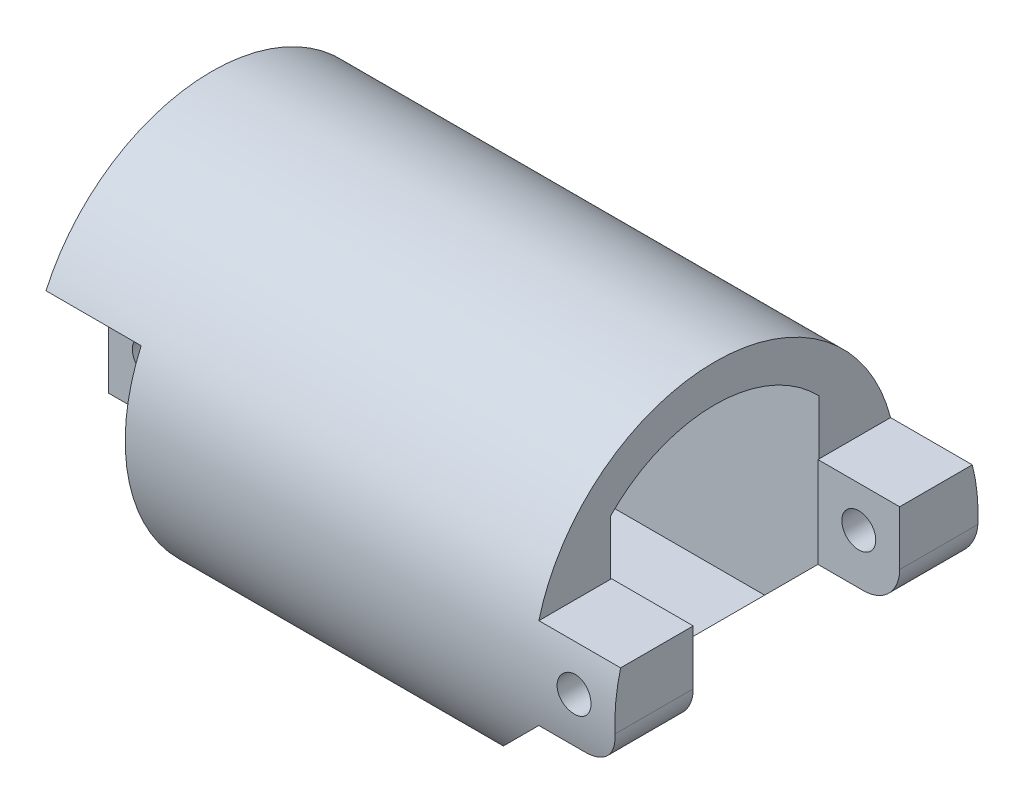
from build123d import *
from build123d.topology import SkipClean

# Parameters (mm, degrees)
SKETCH1_R           = 10
BOSS_EXTRUDE1_DEPTH = 10
SKETCH4_R           = 1.305
CUT_EXTRUDE3_DEPTH  = 25.5
BOSS_EXTRUDE2_START = 4.5
BOSS_EXTRUDE2_DEPTH = 4.5
SKETCH6_R           = 0.935
CUT_EXTRUDE4_DEPTH  = 12.25
SKETCH7_W           = 11.364916732
SKETCH7_H           = 5
BOSS_EXTRUDE3_DEPTH = 4.5
SKETCH8_R           = 0.935
CUT_EXTRUDE5_DEPTH  = 7.25
BOSS_EXTRUDE4_DEPTH = 4.5
CUT_EXTRUDE6_START  = -0.75
CUT_EXTRUDE6_DEPTH  = 0.75
SKETCH12_W          = 5.25
SKETCH12_H          = 4
CUT_EXTRUDE7_DEPTH  = 1.6
CUT_EXTRUDE8_DEPTH  = 15.8
FILLET1_R           = 2
CUT_EXTRUDE9_DEPTH  = 10.8
SKETCH15_W          = 11.364916732
SKETCH15_H          = 6.6
CUT_EXTRUDE10_DEPTH = 1.6
CUT_EXTRUDE11_DEPTH = 15
BOSS_EXTRUDE5_REACH = 35.438
SKETCH17_R          = 10
SKETCH17_R_2        = 1.305
CUT_EXTRUDE12_DEPTH = 14
SCALE1_SCALE        = 0.8


with BuildPart() as part:
    # Sketch1 → Boss-Extrude1 (new, symmetric)
    with BuildSketch(Plane(origin=(0, 0, 0), x_dir=(0, 0, -1), z_dir=(1, 0, 0))):
        Circle(SKETCH1_R)
    extrude(amount=BOSS_EXTRUDE1_DEPTH, both=True)

    # Sketch4 → Cut-Extrude3 (cut, symmetric)
    with BuildSketch(Plane(origin=(0, -0.76336978, 0), x_dir=(0, 0, -1), z_dir=(1, 0, 0))):
        with Locations((0, -6.913267104)):
            Circle(SKETCH4_R)
    extrude(amount=CUT_EXTRUDE3_DEPTH, both=True, mode=Mode.SUBTRACT)

    # Sketch5 → Boss-Extrude2 (add)
    with BuildSketch(Plane(origin=(10, 0, 0), x_dir=(0, 0, -1), z_dir=(1, 0, 0)).offset(BOSS_EXTRUDE2_START)):
        with BuildLine():
            Line((-9.682458366, -2.5), (-5.682458366, -2.5))
            Line((-5.682458366, -2.5), (-5.682458366, 2.5))
            Line((-5.682458366, 2.5), (-9.682458366, 2.5))
            ThreePointArc((-9.682458366, 2.5), (-10, 0), (-9.682458366, -2.5))
        make_face()
    boss_extrude2 = extrude(amount=-BOSS_EXTRUDE2_DEPTH)

    # Mirror1: Boss-Extrude2 across plane
    add(boss_extrude2.mirror(Plane.XY))

    # Sketch6 → Cut-Extrude4 (cut, symmetric)
    with SkipClean():  # the faces are left unmerged after this step: merging them gives an invalid solid
        with BuildSketch(Plane.XY):
            with Locations((12.25, 0.25)):
                Circle(SKETCH6_R)
        extrude(amount=CUT_EXTRUDE4_DEPTH, both=True, mode=Mode.SUBTRACT)

    # Sketch7 → Boss-Extrude3 (add)
    with SkipClean():  # the faces are left unmerged after this step: merging them gives an invalid solid
        with BuildSketch(Plane.ZY.offset(10)):
            Rectangle(SKETCH7_W, SKETCH7_H)
        extrude(amount=BOSS_EXTRUDE3_DEPTH)

    # Sketch8 → Cut-Extrude5 (cut, symmetric)
    with SkipClean():  # the faces are left unmerged after this step: merging them gives an invalid solid
        with BuildSketch(Plane.XY):
            with Locations((-12.25, 0.25)):
                Circle(SKETCH8_R)
        extrude(amount=CUT_EXTRUDE5_DEPTH, both=True, mode=Mode.SUBTRACT)

    # Sketch10 → Boss-Extrude4 (add)
    with SkipClean():  # the faces are left unmerged after this step: merging them gives an invalid solid
        with BuildSketch(Plane.ZY.offset(10)):
            with BuildLine():
                Line((9.682458366, 2.5), (-9.682458366, 2.5))
                ThreePointArc((-9.682458366, 2.5), (0, 10), (9.682458366, 2.5))
            make_face()
        extrude(amount=BOSS_EXTRUDE4_DEPTH)

    # Cut-Extrude6: read off the stored shape, not the designer's step
    # Cut-Extrude6 outline → Cut-Extrude6 (cut)
    with SkipClean():  # the faces are left unmerged after this step: merging them gives an invalid solid
        with BuildSketch(Plane.ZY.offset(10).offset(CUT_EXTRUDE6_START)):
            with BuildLine():
                ThreePointArc((-9.682458366, 2.5), (-9.369942303, -3.493448331), (-5.682458366, -8.228588392))
                Line((-5.682458366, -8.228588392), (-5.682458366, 2.5))
                Line((-5.682458366, 2.5), (-9.682458366, 2.5))
            make_face()
            with BuildLine():
                Line((5.682458366, 2.5), (5.682458366, -8.228588392))
                ThreePointArc((5.682458366, -8.228588392), (9.369942303, -3.493448331), (9.682458366, 2.5))
                Line((9.682458366, 2.5), (5.682458366, 2.5))
            make_face()
        extrude(amount=CUT_EXTRUDE6_DEPTH, mode=Mode.SUBTRACT)

    # Sketch12 → Cut-Extrude7 (cut)
    with SkipClean():  # the faces are left unmerged after this step: merging them gives an invalid solid
        with BuildSketch(Plane.XZ.offset(-2.5)):
            with Locations((-11.875, -7.682458366)):
                Rectangle(SKETCH12_W, SKETCH12_H)
            with Locations((-11.875, 7.682458366)):
                Rectangle(SKETCH12_W, SKETCH12_H)
        extrude(amount=-CUT_EXTRUDE7_DEPTH, mode=Mode.SUBTRACT)

    # Sketch13 → Cut-Extrude8 (cut, symmetric)
    with SkipClean():  # the faces are left unmerged after this step: merging them gives an invalid solid
        with BuildSketch(Plane.XY):
            Polygon((-10, -8.228588392), (-10, -2.5), (-2.5, -10), (-10, -10), align=None)
        extrude(amount=CUT_EXTRUDE8_DEPTH, both=True, mode=Mode.SUBTRACT)

    # Fillet1
    fillet1_edges = [part.edges().sort_by_distance(p)[0] for p in [
        (14.5, -2.5, 7.682458366),
        (14.5, -2.5, -7.682458366),
    ]]
    fillet(fillet1_edges, radius=FILLET1_R)

    # Sketch14 → Cut-Extrude9 (cut, symmetric)
    with SkipClean():  # the faces are left unmerged after this step: merging them gives an invalid solid
        with BuildSketch(Plane.XY):
            Polygon((10, -10), (10, -2.5), (2.5, -10), align=None)
        extrude(amount=CUT_EXTRUDE9_DEPTH, both=True, mode=Mode.SUBTRACT)

    # Sketch15 → Cut-Extrude10 (cut)
    with SkipClean():  # the faces are left unmerged after this step: merging them gives an invalid solid
        with BuildSketch(Plane(origin=(10, 0, 0), x_dir=(0, 0, -1), z_dir=(1, 0, 0))):
            with Locations((0, -0.8)):
                Rectangle(SKETCH15_W, SKETCH15_H)
        extrude(amount=-CUT_EXTRUDE10_DEPTH, mode=Mode.SUBTRACT)

    # Sketch16 → Cut-Extrude11 (cut)
    with SkipClean():  # the faces are left unmerged after this step: merging them gives an invalid solid
        with BuildSketch(Plane(origin=(10, 0, 0), x_dir=(0, 0, -1), z_dir=(1, 0, 0))):
            with BuildLine():
                Line((-5.75, 5.5), (-5.75, -5.5))
                Line((-5.75, -5.5), (5.75, -5.5))
                Line((5.75, -5.5), (5.75, 5.5))
                ThreePointArc((5.75, 5.5), (0, 7.956915231), (-5.75, 5.5))
            make_face()
        extrude(amount=-CUT_EXTRUDE11_DEPTH, mode=Mode.SUBTRACT)


with BuildPart() as body_2:
    # Split1: the piece on the far side of the plane
    add(part.part)
    split(bisect_by=Plane(origin=(0, 0, 0), x_dir=(0, 0, 1), z_dir=(1, 0, 0)), keep=Keep.BOTTOM)


with BuildPart() as part_1:
    add(part.part)

    # Split1
    split(bisect_by=Plane(origin=(0, 0, 0), x_dir=(0, 0, 1), z_dir=(1, 0, 0)), keep=Keep.TOP)


with BuildPart() as part_2:
    # Body-Move/Copy1: moved
    add(part_1.part.moved(Location((15.8, 0, 0))))


    # Sketch17 → Boss-Extrude5 (add, up to next)
    with BuildSketch(Plane.ZY.offset(-15.8), mode=Mode.PRIVATE) as boss_extrude5_sk1:
        with Locations(Location((0, 0, 0), (0, 0, 357.134016017))):
            Circle(SKETCH17_R)
        with Locations(Location((0, -7.676636884, 0), (0, 0, 180))):
            Circle(SKETCH17_R_2, mode=Mode.SUBTRACT)
        with BuildLine():
            Line((-5.75, -5.5), (5.75, -5.5))
            Line((5.75, -5.5), (5.75, 5.5))
            ThreePointArc((5.75, 5.5), (0, 7.956915231), (-5.75, 5.5))
            Line((-5.75, 5.5), (-5.75, -5.5))
        make_face(mode=Mode.SUBTRACT)
    boss_extrude5_tool1 = extrude(boss_extrude5_sk1.sketch, amount=BOSS_EXTRUDE5_REACH, mode=Mode.PRIVATE) - body_2.part
    add(boss_extrude5_tool1.solids().sort_by_distance((15.8, 0.485858, -9.705003))[0])


with BuildPart() as body_2_1:
    # Body-Move/Copy2: moved
    add(body_2.part.moved(Location((9.26, 0, 0))))

    # Combine4: union part
    add(part_2.part)

    # Sketch18 → Cut-Extrude12 (cut)
    with SkipClean():  # the faces are left unmerged after this step: merging them gives an invalid solid
        with BuildSketch(Plane.ZY.offset(5.24)):
            with BuildLine():
                Line((-5.75, 5.5), (-5.75, 4.1))
                Line((-5.75, 4.1), (5.75, 4.1))
                Line((5.75, 4.1), (5.75, 5.5))
                ThreePointArc((5.75, 5.5), (0, 7.956915231), (-5.75, 5.5))
            make_face()
        extrude(amount=-CUT_EXTRUDE12_DEPTH, mode=Mode.SUBTRACT)


with BuildPart() as body_2_2:
    # Scale1: scaled about (10.157754057, 0.26372377, 1.86e-07)
    add(body_2_1.part.scale(SCALE1_SCALE).moved(Location((2.031550811, 0.052744754, 3.7e-08))))


with BuildPart() as body_2_2_1:
    # Split2: the piece on the far side of the plane
    add(body_2_2.part)
    split(bisect_by=Plane(origin=(10, 0, 0), x_dir=(0, 0, 1), z_dir=(1, 0, 0)), keep=Keep.BOTTOM)


with BuildPart() as body_2_3:
    add(body_2_2.part)

    # Split2
    split(bisect_by=Plane(origin=(10, 0, 0), x_dir=(0, 0, 1), z_dir=(1, 0, 0)), keep=Keep.TOP)


with BuildPart() as body_2_4:
    # Body-Move/Copy3: read off the stored shape, not the designer's step
    # Body-Move/Copy3: moved
    add(body_2_3.part.moved(Location((-2.6715551, 0, 0))))


with BuildPart() as body_2_2_2:
    add(body_2_2_1.part)

    # Combine5: union body 2
    add(body_2_4.part)


solid = body_2_2_2.part
